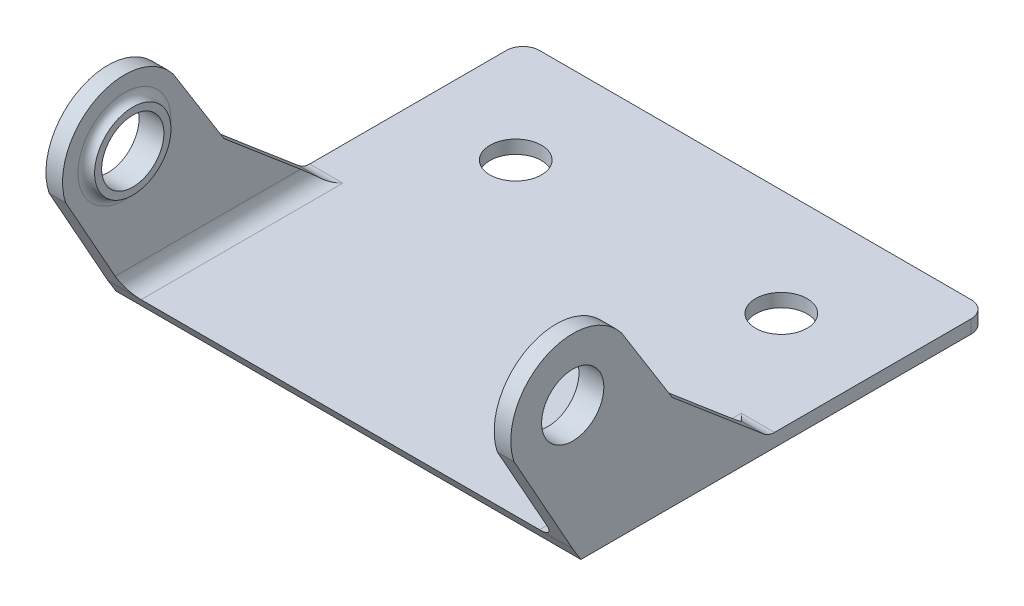
from build123d import *

# Parameters (mm, degrees)
SKETCH1_R           = 2.7051
BOSS_EXTRUDE1_DEPTH = 2.032
CUT_EXTRUDE1_DEPTH  = 90.633545506
BOSS_EXTRUDE2_START = -2.54
SKETCH2_3_R         = 4.7625
BOSS_EXTRUDE2_DEPTH = 2.54
BOSS_EXTRUDE3_START = -71.12
SKETCH2_4_R         = 4.7625
BOSS_EXTRUDE3_DEPTH = 2.54
SKETCH3_W           = 2.54
SKETCH3_H           = 63.5
CUT_EXTRUDE2_DEPTH  = 74.9775539
FILLET1_R           = 2.54
FILLET2_R           = 2.54
FILLET3_R           = 2.54
BOSS_EXTRUDE4_START = 1.27
SKETCH4_R           = 5.842
SKETCH4_R_2         = 4.7625
BOSS_EXTRUDE4_DEPTH = 1.27
FILLET4_R           = 1.27
SKETCH5_R           = 5.842
SKETCH5_R_2         = 4.7625
BOSS_EXTRUDE5_DEPTH = 1.27
FILLET5_R           = 1.27
SKETCH6_R           = 3.937
CUT_EXTRUDE3_DEPTH  = 2.54


with BuildPart() as part:
    # Sketch1 → Boss-Extrude1 (new body)
    with BuildSketch(Plane(origin=(0, 0, 0), x_dir=(1, 0, 0), z_dir=(0, 1, 0))):
        Polygon((-38.1, -47.1551), (-20.32, -47.1551), (20.32, -47.1551), (38.1, -47.1551), (38.1, 16.3449), (-38.1, 16.3449), align=None)
        with Locations(Location((-20.32, 0, 0), (0, 0, 270))):
            Circle(SKETCH1_R, mode=Mode.SUBTRACT)
        with Locations(Location((20.32, 0, 0), (0, 0, 270))):
            Circle(SKETCH1_R, mode=Mode.SUBTRACT)
    extrude(amount=BOSS_EXTRUDE1_DEPTH)

    # Sketch2 → Cut-Extrude1 (cut, through all)
    with BuildSketch(Plane(origin=(38.1, 0, 0), x_dir=(0, 0, -1), z_dir=(1, 0, 0))):
        Polygon((-47.1551, 2.032), (-47.1551, 0), (-45.909587262, 0), align=None)
    extrude(amount=-CUT_EXTRUDE1_DEPTH, mode=Mode.SUBTRACT)

    # Sketch2<3> → Boss-Extrude2 (add)
    with BuildSketch(Plane(origin=(38.1, 0, 0), x_dir=(0, 0, -1), z_dir=(1, 0, 0)).offset(BOSS_EXTRUDE2_START)):
        with BuildLine():
            Line((-17.216664477, 2.032), (-31.930573826, 14.492637507))
            Line((-31.930573826, 14.492637507), (-38.61588269, 25.193525887))
            Line((-38.61588269, 25.193525887), (-39.715274256, 26.953275014))
            ThreePointArc((-39.715274256, 26.953275014), (-51.649026967, 29.426309307), (-56.151659952, 18.101264116))
            Line((-56.151659952, 18.101264116), (-54.398825604, 14.970427636))
            Line((-54.398825604, 14.970427636), (-47.1551, 2.032))
            Line((-47.1551, 2.032), (-24.145873396, 2.032))
            Line((-24.145873396, 2.032), (-17.216664477, 2.032))
        make_face()
        with Locations((-47.1551, 21.082)):
            Circle(SKETCH2_3_R, mode=Mode.SUBTRACT)
    extrude(amount=-BOSS_EXTRUDE2_DEPTH)

    # Sketch2<4> → Boss-Extrude3 (add)
    with BuildSketch(Plane(origin=(38.1, 0, 0), x_dir=(0, 0, -1), z_dir=(1, 0, 0)).offset(BOSS_EXTRUDE3_START)):
        with BuildLine():
            Line((-17.216664477, 2.032), (-31.930573826, 14.492637507))
            Line((-31.930573826, 14.492637507), (-38.61588269, 25.193525887))
            Line((-38.61588269, 25.193525887), (-39.715274256, 26.953275014))
            ThreePointArc((-39.715274256, 26.953275014), (-51.649026967, 29.426309307), (-56.151659952, 18.101264116))
            Line((-56.151659952, 18.101264116), (-54.398825604, 14.970427636))
            Line((-54.398825604, 14.970427636), (-47.1551, 2.032))
            Line((-47.1551, 2.032), (-24.145873396, 2.032))
            Line((-24.145873396, 2.032), (-17.216664477, 2.032))
        make_face()
        with Locations((-47.1551, 21.082)):
            Circle(SKETCH2_4_R, mode=Mode.SUBTRACT)
    extrude(amount=-BOSS_EXTRUDE3_DEPTH)

    # Sketch3 → Cut-Extrude2 (cut, through all)
    with BuildSketch(Plane(origin=(0, 2.032, 0), x_dir=(1, 0, 0), z_dir=(0, 1, 0))):
        with Locations((-36.83, -15.4051)):
            Rectangle(SKETCH3_W, SKETCH3_H)
        Polygon((35.56, -47.1551), (38.1, -47.1551), (38.1, 16.3449), (36.83, 16.3449), (35.56, 16.3449), align=None)
    extrude(amount=-CUT_EXTRUDE2_DEPTH, mode=Mode.SUBTRACT)

    # Fillet1
    fillet1_edges = [part.edges().sort_by_distance(p)[0] for p in [
        (34.29, 2.032, 17.216664477),
        (33.02, 2.032, 32.185882239),
        (-33.02, 2.032, 32.185882239),
        (-34.29, 2.032, 17.216664477),
    ]]
    fillet(fillet1_edges, radius=FILLET1_R)

    # Fillet2
    fillet2_edges = [part.edges().sort_by_distance(p)[0] for p in [
        (-35.56, 1.016, -16.3449),
    ]]
    fillet(fillet2_edges, radius=FILLET2_R)

    # Fillet3
    fillet3_edges = [part.edges().sort_by_distance(p)[0] for p in [
        (35.56, 1.016, -16.3449),
    ]]
    fillet(fillet3_edges, radius=FILLET3_R)

    # Sketch4 → Boss-Extrude4 (add)
    with BuildSketch(Plane(origin=(-33.02, 0, 0), x_dir=(0, 0, -1), z_dir=(1, 0, 0)).offset(BOSS_EXTRUDE4_START)):
        with Locations((-47.1551, 21.082)):
            Circle(SKETCH4_R)
        with Locations((-47.1551, 21.082)):
            Circle(SKETCH4_R_2, mode=Mode.SUBTRACT)
    extrude(amount=-BOSS_EXTRUDE4_DEPTH)

    # Fillet4
    fillet4_edges = [part.edges().sort_by_distance(p)[0] for p in [
        (-33.02, 21.082, 52.9971),
    ]]
    fillet(fillet4_edges, radius=FILLET4_R - 0.0001)  # a hair under: the kernel refuses the full size

    # Sketch5 → Boss-Extrude5 (add)
    with BuildSketch(Plane.ZY.offset(-33.02)):
        with Locations(Location((47.1551, 21.082, 0), (0, 0, 180))):
            Circle(SKETCH5_R)
        with Locations(Location((47.1551, 21.082, 0), (0, 0, 180))):
            Circle(SKETCH5_R_2, mode=Mode.SUBTRACT)
    extrude(amount=BOSS_EXTRUDE5_DEPTH)

    # Fillet5
    fillet5_edges = [part.edges().sort_by_distance(p)[0] for p in [
        (33.02, 21.082, 52.9971),
    ]]
    fillet(fillet5_edges, radius=FILLET5_R - 0.0001)  # a hair under: the kernel refuses the full size

    # Sketch6 → Cut-Extrude3 (cut)
    with BuildSketch(Plane(origin=(0, 2.032, 0), x_dir=(1, 0, 0), z_dir=(0, 1, 0))):
        with Locations(Location((-20.32, 0, 0), (0, 0, 270))):
            Circle(SKETCH6_R)
        with Locations(Location((20.32, 0, 0), (0, 0, 270))):
            Circle(SKETCH6_R)
    extrude(amount=-CUT_EXTRUDE3_DEPTH, mode=Mode.SUBTRACT)


solid = part.part
